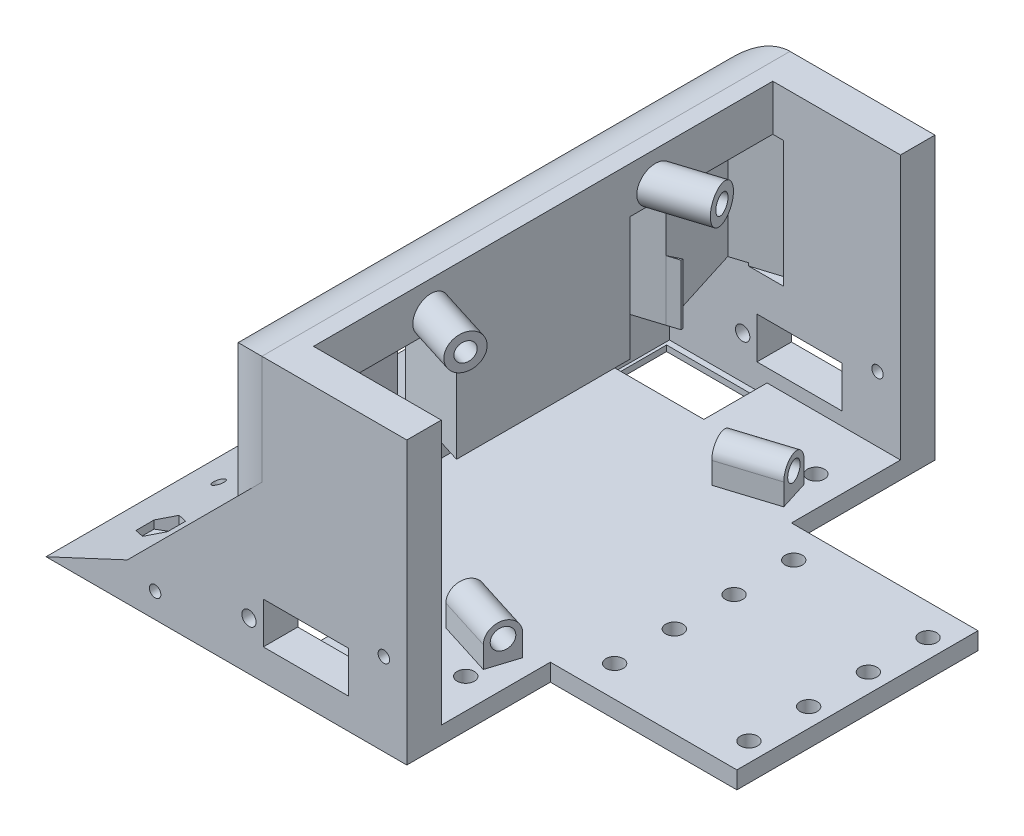
from build123d import *

# Parameters (mm, degrees)
EXTRUDE_1_DEPTH           = 48
EXTRUDE_1_DEPTH_BACK      = 48
SKETCH_2_W                = 35
SKETCH_2_H                = 22
CUT_EXTRUDE_1_DEPTH       = 50
SKETCH_3_W                = 29.5
SKETCH_3_H                = 8.4
CUT_EXTRUDE_2_DEPTH       = 50
SKETCH_7_W                = 29.5
SKETCH_7_H                = 8.4
CUT_EXTRUDE_6_DEPTH       = 116
CUT_EXTRUDE_7_DEPTH       = 40
CUT_EXTRUDE_7_DEPTH_BACK  = 40
SKETCH_8_W                = 4.551430991
SKETCH_8_H                = 6.321078777
CUT_EXTRUDE_8_DEPTH       = 119
SKETCH_11_R               = 1.25
EXTRUDE_2_DEPTH           = 8
SKETCH_12_R               = 1.25
EXTRUDE_3_DEPTH           = 8
CUT_EXTRUDE_9_DEPTH       = 3
SKETCH_10_R               = 1.5
CUT_EXTRUDE_11_DEPTH      = 3
SKETCH_14_W               = 32.5
SKETCH_14_H               = 42
SKETCH_14_R               = 1.5
EXTRUDE_4_DEPTH           = 1.021078777
SKETCH_15_W               = 96
SKETCH_15_H               = 1
CUT_EXTRUDE_12_DEPTH      = 120.625457157
CUT_EXTRUDE_13_DEPTH      = 94.036621877
CUT_EXTRUDE_13_DEPTH_BACK = 94.036621877
SKETCH_16_W               = 2
SKETCH_16_H               = 20.042157554
CUT_EXTRUDE_14_DEPTH      = 18
SKETCH_19_W               = 17
SKETCH_19_H               = 11
CUT_EXTRUDE_15_DEPTH      = 10
SKETCH_20_W               = 17
SKETCH_20_H               = 11
SKETCH_20_W_2             = 16
SKETCH_20_H_2             = 9
EXTRUDE_5_DEPTH           = 1
EXTRUDE_6_DEPTH           = 10
CUT_EXTRUDE_16_DEPTH      = 22
SKETCH_24_W               = 92
SKETCH_24_H               = 19
EXTRUDE_7_DEPTH           = 3
CUT_EXTRUDE_START         = -19.521079
CUT_EXTRUDE_17_DEPTH      = 19.521079
CUT_EXTRUDE_18_DEPTH      = 11
EXTRUDE_8_REACH           = 111.942
CUT_EXTRUDE_19_DEPTH      = 4
EXTRUDE_9_DEPTH           = 11
EXTRUDE_10_DEPTH          = 3
SKETCH_37_R               = 1.5
CUT_EXTRUDE_20_DEPTH      = 10
CUT_EXTRUDE_START_2       = -2
CUT_EXTRUDE_21_DEPTH      = 10
SKETCH_39_R               = 1.5
CUT_EXTRUDE_22_DEPTH      = 10
SKETCH_40_R               = 1
CUT_EXTRUDE_23_DEPTH      = 115.695894512
SKETCH_42_R               = 1.779724169
EXTRUDE_11_DEPTH          = 10
SKETCH_43_R               = 1.650133076
EXTRUDE_12_DEPTH          = 10
EXTRUDE_13_REACH          = 90.598
SKETCH_44_R               = 3.089258807
SKETCH_44_R_2             = 1.627891813
EXTRUDE_14_REACH          = 90.598
SKETCH_45_R               = 3.004758467
SKETCH_45_R_2             = 1.620063924
EXTRUDE_15_DEPTH          = 5
FILLET_1_R                = 10
SKETCH_47_R               = 1.5
CUT_EXTRUDE_24_DEPTH      = 5
SKETCH_48_R               = 1
CUT_EXTRUDE_25_DEPTH      = 5
CUT_EXTRUDE_START_3       = -1.5
CUT_EXTRUDE_26_DEPTH      = 5


with BuildPart() as part:
    # Эскиз1 → Бобышка-Вытянуть1 (new, two sides: drawn at the far end of the back side and taken through both)
    with BuildSketch(Plane.XY.offset(-EXTRUDE_1_DEPTH_BACK)):
        Polygon((-50, -50), (-33.686459833, -42.392871289), (-20.251430991, -28.957842446), (-7.251430991, -28.957842446), (-7.251430991, -39.957842446), (10.448569009, -39.957842446), (10.448569009, -28.957842446), (15, -28.957842446), (15, -47), (50, -47), (50, -50), align=None)
    extrude(amount=EXTRUDE_1_DEPTH + EXTRUDE_1_DEPTH_BACK)

    # Эскиз2 → Вырез-Вытянуть1 (cut)
    with BuildSketch(Plane(origin=(0, -47, 0), x_dir=(1, 0, 0), z_dir=(0, 1, 0))):
        with Locations((32.5, 37)):
            Rectangle(SKETCH_2_W, SKETCH_2_H)
        with Locations((32.5, -37)):
            Rectangle(SKETCH_2_W, SKETCH_2_H)
    extrude(amount=-CUT_EXTRUDE_1_DEPTH, mode=Mode.SUBTRACT)

    # Эскиз3 → Вырез-Вытянуть2 (cut)
    with BuildSketch(Plane(origin=(0, 0, 0), x_dir=(0, 0, -1), z_dir=(1, 0, 0))):
        with Locations((-24, -33.657842446)):
            Rectangle(SKETCH_3_W, SKETCH_3_H)
        with Locations((24, -33.657842446)):
            Rectangle(SKETCH_3_W, SKETCH_3_H)
    extrude(amount=-CUT_EXTRUDE_2_DEPTH, mode=Mode.SUBTRACT)

    # Эскиз7 → Вырез-Вытянуть6 (cut)
    with BuildSketch(Plane.XY.offset(48)):
        with Locations((0.25, -39.478921223)):
            Rectangle(SKETCH_7_W, SKETCH_7_H)
    extrude(amount=-CUT_EXTRUDE_6_DEPTH, mode=Mode.SUBTRACT)


with BuildPart() as cut_extrude_6_piece_1:
    # of the separate pieces the step leaves, piece 1, a body of its own (cut_extrude_6_pieces)
    add(part.part.solids().sort_by_distance((-50, -50, 48))[0])


with BuildPart() as cut_extrude_6_piece_2:
    # of the separate pieces the step leaves, piece 2, a body of its own (cut_extrude_6_pieces)
    add(part.part.solids().sort_by_distance((15, -35.278921223, 48))[0])


with BuildPart() as cut_extrude_7_tool:
    # Эскиз6 → Вырез-Вытянуть7 (new, two sides: drawn at the far end of the back side and taken through both)
    with BuildSketch(Plane.XY.offset(-CUT_EXTRUDE_7_DEPTH_BACK)):
        with BuildLine():
            Line((15, -32.978921223), (5.3, -32.978921223))
            Line((5.3, -32.978921223), (5.3, -27.078921223))
            Line((5.3, -27.078921223), (-4.8, -27.078921223))
            Line((-4.8, -27.078921223), (-4.8, -32.978921223))
            Line((-4.8, -32.978921223), (-14.5, -32.978921223))
            Line((-14.5, -32.978921223), (-14.5, -35.728921223))
            Line((-14.5, -35.728921223), (-20.25, -35.728921223))
            ThreePointArc((-20.25, -35.728921223), (-24, -39.478921223), (-20.25, -43.228921223))
            Line((-20.25, -43.228921223), (-14.5, -43.228921223))
            Line((-14.5, -43.228921223), (-14.5, -45.978921223))
            Line((-14.5, -45.978921223), (15, -45.978921223))
            Line((15, -45.978921223), (15, -43.228921223))
            Line((15, -43.228921223), (16.75, -43.228921223))
            ThreePointArc((16.75, -43.228921223), (20.5, -39.478921223), (16.75, -35.728921223))
            Line((16.75, -35.728921223), (15, -35.728921223))
            Line((15, -35.728921223), (15, -32.978921223))
        make_face()
    extrude(amount=CUT_EXTRUDE_7_DEPTH + CUT_EXTRUDE_7_DEPTH_BACK)


with BuildPart() as cut_extrude_6_piece_1_1:
    add(cut_extrude_6_piece_1.part)

    # Вырез-Вытянуть7: cut by cut_extrude_7_tool
    add(cut_extrude_7_tool.part, mode=Mode.SUBTRACT)

    # Эскиз11 → Бобышка-Вытянуть2 (add)
    with BuildSketch(Plane(origin=(0, 0, -48), x_dir=(-1, 0, 0), z_dir=(0, 0, -1))):
        Polygon((14.5, -43.678921223), (10, -43.678921223), (10, -36.459984998), (-4.798276813, -36.459984998), (-4.798276813, -43.678921223), (-15, -43.678921223), (-15, -35.278921223), (-15, -28.957842446), (7.251430991, -28.957842446), (7.251430991, -35.278921223), (14.5, -35.278921223), align=None)
        with Locations((12.5, -40.578921223)):
            Circle(SKETCH_11_R, mode=Mode.SUBTRACT)
    extrude(amount=-EXTRUDE_2_DEPTH)

    # Эскиз12 → Бобышка-Вытянуть3 (add)
    with BuildSketch(Plane.XY.offset(48)):
        Polygon((15, -28.957842446), (15, -35.278921223), (15, -43.678921223), (4.798276813, -43.678921223), (4.798276813, -36.459984998), (-10, -36.459984998), (-10, -43.678921223), (-14.5, -43.678921223), (-14.5, -35.278921223), (-7.251430991, -35.278921223), (-7.251430991, -28.957842446), align=None)
        with Locations(Location((-12.5, -40.578921223, 0), (0, 0, 180))):
            Circle(SKETCH_12_R, mode=Mode.SUBTRACT)
    extrude(amount=-EXTRUDE_3_DEPTH)

    # Эскиз13 → Вырез-Вытянуть9 (cut)
    with BuildSketch(Plane(origin=(0, -47, 0), x_dir=(1, 0, 0), z_dir=(0, 1, 0))):
        Polygon((15, -26), (50, -26), (50, -21), (50, 21), (50, 26), (15, 26), (15, 21), (47.5, 21), (47.5, -21), (15, -21), align=None)
    extrude(amount=-CUT_EXTRUDE_9_DEPTH, mode=Mode.SUBTRACT)

    # Эскиз10 → Вырез-Вытянуть11 (cut)
    with BuildSketch(Plane(origin=(0, -47, 0), x_dir=(1, 0, 0), z_dir=(0, 1, 0))):
        with Locations(Location((44.2, -15.6, 0), (0, 0, 270))):
            Circle(SKETCH_10_R)
        with Locations(Location((20.8, -15.6, 0), (0, 0, 270))):
            Circle(SKETCH_10_R)
        with Locations(Location((20.8, -5.2, 0), (0, 0, 270))):
            Circle(SKETCH_10_R)
        with Locations(Location((20.8, 5.2, 0), (0, 0, 270))):
            Circle(SKETCH_10_R)
        with Locations(Location((20.8, 15.6, 0), (0, 0, 270))):
            Circle(SKETCH_10_R)
        with Locations(Location((44.2, 15.6, 0), (0, 0, 270))):
            Circle(SKETCH_10_R)
        with Locations(Location((44.2, 5.2, 0), (0, 0, 270))):
            Circle(SKETCH_10_R)
        with Locations(Location((44.2, -5.2, 0), (0, 0, 270))):
            Circle(SKETCH_10_R)
    extrude(amount=-CUT_EXTRUDE_11_DEPTH, mode=Mode.SUBTRACT)

    # Эскиз14 → Бобышка-Вытянуть4 (add)
    with BuildSketch(Plane(origin=(0, -47, 0), x_dir=(1, 0, 0), z_dir=(0, 1, 0))):
        with Locations((31.25, 0)):
            Rectangle(SKETCH_14_W, SKETCH_14_H)
        with Locations(Location((20.8, -15.6, 0), (0, 0, 270))):
            Circle(SKETCH_14_R, mode=Mode.SUBTRACT)
        with Locations(Location((20.8, -5.2, 0), (0, 0, 270))):
            Circle(SKETCH_14_R, mode=Mode.SUBTRACT)
        with Locations(Location((20.8, 5.2, 0), (0, 0, 270))):
            Circle(SKETCH_14_R, mode=Mode.SUBTRACT)
        with Locations(Location((20.8, 15.6, 0), (0, 0, 270))):
            Circle(SKETCH_14_R, mode=Mode.SUBTRACT)
        with Locations(Location((44.2, 15.6, 0), (0, 0, 270))):
            Circle(SKETCH_14_R, mode=Mode.SUBTRACT)
        with Locations(Location((44.2, 5.2, 0), (0, 0, 270))):
            Circle(SKETCH_14_R, mode=Mode.SUBTRACT)
        with Locations(Location((44.2, -5.2, 0), (0, 0, 270))):
            Circle(SKETCH_14_R, mode=Mode.SUBTRACT)
        with Locations(Location((44.2, -15.6, 0), (0, 0, 270))):
            Circle(SKETCH_14_R, mode=Mode.SUBTRACT)
    extrude(amount=EXTRUDE_4_DEPTH)

    # Эскиз15 → Вырез-Вытянуть12 (cut, through all)
    with BuildSketch(Plane(origin=(47.5, 0, 0), x_dir=(0, 0, -1), z_dir=(1, 0, 0))):
        with Locations((0, -49.5)):
            Rectangle(SKETCH_15_W, SKETCH_15_H)
    extrude(amount=-CUT_EXTRUDE_12_DEPTH, mode=Mode.SUBTRACT)

    # Эскиз16 → Вырез-Вытянуть13 (cut, two sides: drawn at the far end of the back side and taken through both)
    with BuildSketch(Plane(origin=(15, 0, 0), x_dir=(0, 0, -1), z_dir=(1, 0, 0)).offset(-CUT_EXTRUDE_13_DEPTH_BACK)):
        with Locations((-47, -38.978921223)):
            Rectangle(SKETCH_16_W, SKETCH_16_H)
        with Locations((47, -38.978921223)):
            Rectangle(SKETCH_16_W, SKETCH_16_H)
    extrude(amount=CUT_EXTRUDE_13_DEPTH + CUT_EXTRUDE_13_DEPTH_BACK, mode=Mode.SUBTRACT)

    # Эскиз18 → Вырез-Вытянуть14 (cut)
    with BuildSketch(Plane(origin=(-7.251430991, 0, 0), x_dir=(0, 0, -1), z_dir=(1, 0, 0))):
        Polygon((-40, -30.968381835), (-40, -43.228921223), (-40, -45.978921223), (40, -45.978921223), (40, -43.228921223), (40, -30.968381835), (40, -29.468381835), (-40, -29.468381835), align=None)
    extrude(amount=-CUT_EXTRUDE_14_DEPTH, mode=Mode.SUBTRACT)

    # Эскиз19 → Вырез-Вытянуть15 (cut)
    with BuildSketch(Plane(origin=(0, -45.978921223, 0), x_dir=(1, 0, 0), z_dir=(0, 1, 0))):
        with Locations((-16.751430991, -34.5)):
            Rectangle(SKETCH_19_W, SKETCH_19_H)
        with Locations((-16.751430991, 34.5)):
            Rectangle(SKETCH_19_W, SKETCH_19_H)
    extrude(amount=-CUT_EXTRUDE_15_DEPTH, mode=Mode.SUBTRACT)

    # Эскиз20 → Бобышка-Вытянуть5 (add)
    # profile 1 of 2: a face of its own
    with BuildSketch(Plane.XZ.offset(49)):
        with Locations((-16.751430991, -34.5)):
            Rectangle(SKETCH_20_W, SKETCH_20_H)
        with Locations((-16.751430991, -34.5)):
            Rectangle(SKETCH_20_W_2, SKETCH_20_H_2, mode=Mode.SUBTRACT)
    # profile 2 of 2: a face of its own
    with BuildSketch(Plane.XZ.offset(49)):
        with Locations((-16.751430991, 34.5)):
            Rectangle(SKETCH_20_W, SKETCH_20_H)
        with Locations((-16.751430991, 34.5)):
            Rectangle(SKETCH_20_W_2, SKETCH_20_H_2, mode=Mode.SUBTRACT)
    extrude(amount=-EXTRUDE_5_DEPTH)

    # Эскиз21 → Бобышка-Вытянуть6 (add)
    with BuildSketch(Plane(origin=(0, -28.957842446, 0), x_dir=(1, 0, 0), z_dir=(0, 1, 0))):
        Polygon((-20.251430991, -46), (15, -46), (15, -40), (-7.251430991, -40), (-7.251430991, 40), (15, 40), (15, 46), (-20.251430991, 46), align=None)
    extrude(amount=EXTRUDE_6_DEPTH)

    # Эскиз23 → Вырез-Вытянуть16 (cut)
    with BuildSketch(Plane.XY.offset(9.25)):
        Polygon((-29.151430991, -37.857842446), (-25.251430991, -37.857842446), (-25.251430991, -33.957842446), align=None)
    extrude(amount=-CUT_EXTRUDE_16_DEPTH, mode=Mode.SUBTRACT)

    # Эскиз24 → Бобышка-Вытянуть7 (add)
    with BuildSketch(Plane(origin=(4.353205728, -4.353205728, 0), x_dir=(0, 0, 1), z_dir=(-0.7071067811865485, 0.7071067811865466, 0))):
        with Locations((0, -44.296210945)):
            Rectangle(SKETCH_24_W, SKETCH_24_H)
    extrude(amount=-EXTRUDE_7_DEPTH)

    # Эскиз25 → Вырез-Вытянуть17 (cut)
    with BuildSketch(Plane(origin=(0, -18.957842446, 0), x_dir=(1, 0, 0), z_dir=(0, 1, 0)).offset(CUT_EXTRUDE_START)):
        Polygon((-5.732587345, -24.487517777), (-10.024313623, -23.134341679), (-24.044692382, -18.713733237), (-43.109006788, -12.702777993), (-42.92180577, -3.849304684), (-7.468314327, -15.027747597), (-3.176588049, -16.380923695), align=None)
        Polygon((-3.176588049, 16.380923695), (-7.468314327, 15.027747597), (-42.757931091, 3.900974172), (-42.56821726, 12.873288277), (-10.024313623, 23.134341679), (-5.732587345, 24.487517777), align=None)
    extrude(amount=CUT_EXTRUDE_17_DEPTH, mode=Mode.SUBTRACT)

    # Эскиз26 → Вырез-Вытянуть18 (cut)
    with BuildSketch(Plane(origin=(0, -18.957842446, 0), x_dir=(1, 0, 0), z_dir=(0, 1, 0))):
        Polygon((-1.33988484, 27.183192963), (-5.933885355, 41.753501116), (-14.228625887, 39.138179472), (-9.258743123, 23.37572513), align=None)
        Polygon((-14.228625887, -39.138179472), (-9.258743123, -23.37572513), (-1.33988484, -27.183192963), (-5.933885355, -41.753501116), align=None)
    extrude(amount=-CUT_EXTRUDE_18_DEPTH, mode=Mode.SUBTRACT)


with BuildPart() as cut_extrude_6_piece_2_1:
    add(cut_extrude_6_piece_2.part)

    # Вырез-Вытянуть7: cut by cut_extrude_7_tool
    add(cut_extrude_7_tool.part, mode=Mode.SUBTRACT)

    # Эскиз8 → Вырез-Вытянуть8 (cut)
    with BuildSketch(Plane(origin=(0, 0, -48), x_dir=(-1, 0, 0), z_dir=(0, 0, -1))):
        with Locations((-12.724284505, -32.118381834)):
            Rectangle(SKETCH_8_W, SKETCH_8_H)
    extrude(amount=-CUT_EXTRUDE_8_DEPTH, mode=Mode.SUBTRACT)


with BuildPart() as cut_extrude_18_piece_1:
    # of the separate pieces the step leaves, piece 1, a body of its own (cut_extrude_18_pieces)
    add(cut_extrude_6_piece_1_1.part.solids().sort_by_distance((-47.855493079, -49, 46))[0])

    # Бобышка-Вытянуть8: up to this face of the body (flat: up to its plane)
    extrude_8_end = Plane(cut_extrude_18_piece_1.part.faces().sort_by_distance((-8.696715334, -46.989460612, 40))[0])
    # Эскиз31 → Бобышка-Вытянуть8 (add, up to the picked face)
    with BuildSketch(Plane.XY.offset(-40), mode=Mode.PRIVATE) as extrude_8_sk1:
        Polygon((-18.130110647, -31.07916279), (-19.740891602, -29.468381835), (-17.345266843, -29.468381835), align=None)
    extrude_8_tool1 = split(extrude(extrude_8_sk1.sketch, amount=EXTRUDE_8_REACH, mode=Mode.PRIVATE), bisect_by=extrude_8_end, keep=Keep.BOTH, mode=Mode.PRIVATE)
    add(extrude_8_tool1.solids().sort_by(Axis((-18.405423, -30.005309, -40), (0, 0, 1)))[0])

    # Эскиз34 → Вырез-Вытянуть19 (cut)
    with BuildSketch(Plane(origin=(0, -29.468381835, 0), x_dir=(1, 0, 0), z_dir=(0, 1, 0))):
        Polygon((-17.345266843, 20.826053995), (-19.740891602, 20.07071641), (-19.740891602, 11.158218846), (-17.345266843, 11.913556431), align=None)
        Polygon((-19.740891602, -11.158218846), (-17.345266843, -11.913556431), (-17.345266843, -20.826053995), (-19.740891602, -20.07071641), align=None)
    extrude(amount=-CUT_EXTRUDE_19_DEPTH, mode=Mode.SUBTRACT)

    # Эскиз35 → Бобышка-Вытянуть9 (add)
    with BuildSketch(Plane(origin=(0, -18.957842446, 0), x_dir=(1, 0, 0), z_dir=(0, 1, 0))):
        Polygon((-9.258743123, 23.37572513), (-14.228625887, 39.138179472), (-5.933885355, 41.753501116), (-5.381008577, 40), (15, 40), (15, 46), (-20.251430991, 46), (-20.251430991, 19.909743959), align=None)
        Polygon((-20.251430991, -10.997246395), (-7.251430991, -15.096130651), (-7.251430991, 15.096130651), (-20.251430991, 10.997246395), align=None)
        Polygon((-14.228625887, -39.138179472), (-9.258743123, -23.37572513), (-20.251430991, -19.909743959), (-20.251430991, -46), (15, -46), (15, -40), (-5.381008577, -40), (-5.933885355, -41.753501116), align=None)
    extrude(amount=EXTRUDE_9_DEPTH)

    # Эскиз36 → Бобышка-Вытянуть10 (add)
    with BuildSketch(Plane(origin=(0, -7.957842446, 0), x_dir=(1, 0, 0), z_dir=(0, 1, 0))):
        Polygon((-20.251430991, -19.909743959), (-20.251430991, -46), (15, -46), (15, -40), (-7.251430991, -40), (-7.251430991, 40), (15, 40), (15, 46), (-20.251430991, 46), (-20.251430991, 10.997246395), align=None)
    extrude(amount=EXTRUDE_10_DEPTH)

    # Эскиз37 → Вырез-Вытянуть20 (cut)
    with BuildSketch(Plane(origin=(0, -49, 0), x_dir=(-1, 0, 0), z_dir=(0, -1, 0))):
        with Locations(Location((37.855493079, 36, 0), (0, 0, 90))):
            Circle(SKETCH_37_R)
        with Locations((37.855493079, -36)):
            Circle(SKETCH_37_R)
    extrude(amount=-CUT_EXTRUDE_20_DEPTH, mode=Mode.SUBTRACT)

    # Эскиз38 → Вырез-Вытянуть21 (cut)
    with BuildSketch(Plane.XZ.offset(49).offset(CUT_EXTRUDE_START_2)):
        Polygon((-37.855493079, -32.824573519), (-40.605493079, -34.41228676), (-40.605493079, -37.58771324), (-37.855493079, -39.175426481), (-35.105493079, -37.58771324), (-35.105493079, -34.41228676), align=None)
        Polygon((-35.105493079, 34.41228676), (-37.855493079, 32.824573519), (-40.605493079, 34.41228676), (-40.605493079, 37.58771324), (-37.855493079, 39.175426481), (-35.105493079, 37.58771324), align=None)
    extrude(amount=-CUT_EXTRUDE_21_DEPTH, mode=Mode.SUBTRACT)

    # Эскиз39 → Вырез-Вытянуть22 (cut)
    with BuildSketch(Plane(origin=(0, -45.978921223, 0), x_dir=(1, 0, 0), z_dir=(0, 1, 0))):
        with Locations(Location((9.763297689, -30.5, 0), (0, 0, 270))):
            Circle(SKETCH_39_R)
        with Locations(Location((9.763297689, 30.5, 0), (0, 0, 270))):
            Circle(SKETCH_39_R)
    extrude(amount=-CUT_EXTRUDE_22_DEPTH, mode=Mode.SUBTRACT)

    # Эскиз40 → Вырез-Вытянуть23 (cut, through all)
    with BuildSketch(Plane.XY.offset(46)):
        with Locations((-28.845458385, -44.710050328)):
            Circle(SKETCH_40_R)
        with Locations((10.992087761, -34.64156265)):
            Circle(SKETCH_40_R)
    extrude(amount=-CUT_EXTRUDE_23_DEPTH, mode=Mode.SUBTRACT)

    # Эскиз42 → Бобышка-Вытянуть11 (add)
    with BuildSketch(Plane(origin=(7.819521326, 0, 2.465485604), x_dir=(0.300705799504272, 0, -0.9537169507482274), z_dir=(0.9537169507482273, 0, 0.30070579950427195))):
        with BuildLine():
            Line((-23.561659777, -42.228921223), (-23.561659777, -46.548803265))
            Line((-23.561659777, -46.548803265), (-18.094306315, -46.548803265))
            Line((-18.094306315, -46.548803265), (-18.094306315, -42.228921223))
            ThreePointArc((-18.094306315, -42.228921223), (-20.827983046, -39.495244492), (-23.561659777, -42.228921223))
        make_face()
        with Locations(Location((-20.827983046, -42.228921223, 0), (0, 0, 180))):
            Circle(SKETCH_42_R, mode=Mode.SUBTRACT)
    extrude(amount=EXTRUDE_11_DEPTH)

    # Эскиз43 → Бобышка-Вытянуть12 (add)
    with BuildSketch(Plane(origin=(7.819521326, 0, -2.465485604), x_dir=(-0.300705799504272, 0, -0.9537169507482274), z_dir=(0.9537169507482273, 0, -0.30070579950427195))):
        with BuildLine():
            Line((18.124879759, -42.228921223), (18.124879759, -47.781885183))
            Line((18.124879759, -47.781885183), (23.531086333, -47.781885183))
            Line((23.531086333, -47.781885183), (23.531086333, -42.228921223))
            ThreePointArc((23.531086333, -42.228921223), (20.827983046, -39.525817936), (18.124879759, -42.228921223))
        make_face()
        with Locations(Location((20.827983046, -42.228921223, 0), (0, 0, 180))):
            Circle(SKETCH_43_R, mode=Mode.SUBTRACT)
    extrude(amount=EXTRUDE_12_DEPTH)

    # Бобышка-Вытянуть13: up to this plane
    extrude_13_end = Plane(origin=(-7.251430991, -28.957842446, -48), z_dir=(1, 0, 0))
    # Эскиз44 → Бобышка-Вытянуть13 (add, up to the surface)
    with BuildSketch(Plane(origin=(7.819521326, 0, -2.465485604), x_dir=(-0.300705799504272, 0, -0.9537169507482274), z_dir=(0.9537169507482273, 0, -0.30070579950427195)), mode=Mode.PRIVATE) as extrude_13_sk1:
        with Locations((20.827983046, -5.228921223)):
            Circle(SKETCH_44_R)
        with Locations((20.827983046, -5.228921223)):
            Circle(SKETCH_44_R_2, mode=Mode.SUBTRACT)
    extrude_13_tool1 = split(extrude(extrude_13_sk1.sketch, amount=-EXTRUDE_13_REACH, mode=Mode.PRIVATE), bisect_by=extrude_13_end, keep=Keep.BOTH, mode=Mode.PRIVATE)
    add(extrude_13_tool1.solids().sort_by_distance((2.459109, -5.228921, -19.466541))[0])

    # Бобышка-Вытянуть14: up to this plane
    extrude_14_end = Plane(origin=(-7.251430991, -28.957842446, -48), z_dir=(1, 0, 0))
    # Эскиз45 → Бобышка-Вытянуть14 (add, up to the surface)
    with BuildSketch(Plane(origin=(7.819521326, 0, 2.465485604), x_dir=(0.300705799504272, 0, -0.9537169507482274), z_dir=(0.9537169507482273, 0, 0.30070579950427195)), mode=Mode.PRIVATE) as extrude_14_sk1:
        with Locations((-20.827983046, -5.228921223)):
            Circle(SKETCH_45_R)
        with Locations((-20.827983046, -5.228921223)):
            Circle(SKETCH_45_R_2, mode=Mode.SUBTRACT)
    extrude_14_tool1 = split(extrude(extrude_14_sk1.sketch, amount=-EXTRUDE_14_REACH, mode=Mode.PRIVATE), bisect_by=extrude_14_end, keep=Keep.BOTH, mode=Mode.PRIVATE)
    add(extrude_14_tool1.solids().sort_by_distance((0.678434, -5.228921, 25.114121))[0])

    # Эскиз46 → Бобышка-Вытянуть15 (add)
    with BuildSketch(Plane(origin=(0, -4.957842446, 0), x_dir=(1, 0, 0), z_dir=(0, 1, 0))):
        Polygon((15, 46), (-20.251430991, 46), (-20.251430991, -46), (15, -46), (15, -40), (-7.251430991, -40), (-7.251430991, -22.690108707), (-7.251430991, -21.227114958), (-7.251430991, -17.877643907), (-7.251430991, -16.414650158), (-7.251430991, 16.325696294), (-7.251430991, 17.869319344), (-7.251430991, 21.235439522), (-7.251430991, 22.779062571), (-7.251430991, 40), (15, 40), align=None)
    extrude(amount=EXTRUDE_15_DEPTH)

    # Скругление1
    # the kernel refuses this fillet: 10 mm, written as the material it takes off along each edge
    with BuildSketch(Plane(origin=(-20.251430991, 0.042157554, -71), x_dir=(0, -1, 0), z_dir=(0, 0, 1))) as fillet_1_piece_1:
        with BuildLine():
            CenterArc((FILLET_1_R, FILLET_1_R), FILLET_1_R, 180, 90)
            Line((0, FILLET_1_R), (0, 0))
            Line((0, 0), (FILLET_1_R, 0))
        make_face()
    extrude(amount=142, mode=Mode.SUBTRACT)
    with BuildSketch(Plane(origin=(-20.251430991, -18.957842446, 46), x_dir=(0, 0, -1), z_dir=(0, 1, 0))) as fillet_1_piece_2:
        with BuildLine():
            CenterArc((FILLET_1_R, -FILLET_1_R), FILLET_1_R, 90, 90)
            Line((0, -FILLET_1_R), (0, 0))
            Line((0, 0), (FILLET_1_R, 0))
        make_face()
    extrude(amount=11, mode=Mode.SUBTRACT)
    with BuildSketch(Plane(origin=(-20.251430991, -18.957842446, -46), x_dir=(0, 0, 1), z_dir=(0, 1, 0))) as fillet_1_piece_3:
        with BuildLine():
            CenterArc((FILLET_1_R, FILLET_1_R), FILLET_1_R, 180, 90)
            Line((0, FILLET_1_R), (0, 0))
            Line((0, 0), (FILLET_1_R, 0))
        make_face()
    extrude(amount=11, mode=Mode.SUBTRACT)
    with BuildSketch(Plane(origin=(-20.251430991, -53.957842446, -46), x_dir=(0, 0, 1), z_dir=(0, 1, 0))) as fillet_1_piece_4_section:
        with BuildLine():
            CenterArc((FILLET_1_R, FILLET_1_R), FILLET_1_R, 180, 90)
            Line((0, FILLET_1_R), (0, 0))
            Line((0, 0), (FILLET_1_R, 0))
        make_face()
    fillet_1_piece_4 = extrude(amount=35, mode=Mode.PRIVATE)
    fillet_1_piece_4 = split(fillet_1_piece_4, bisect_by=Plane(origin=(-16.504052653, -25.210464108, -43.381129818), z_dir=(-0.7071067811865488, 0.7071067811865464, 0)), keep=Keep.TOP, mode=Mode.PRIVATE)
    add(fillet_1_piece_4, mode=Mode.SUBTRACT)
    with BuildSketch(Plane(origin=(-20.251430991, -7.957842446, -46), x_dir=(0, 0, 1), z_dir=(0, 1, 0))) as fillet_1_piece_5:
        with BuildLine():
            CenterArc((FILLET_1_R, FILLET_1_R), FILLET_1_R, 180, 90)
            Line((0, FILLET_1_R), (0, 0))
            Line((0, 0), (FILLET_1_R, 0))
        make_face()
    extrude(amount=3, mode=Mode.SUBTRACT)
    with BuildSketch(Plane(origin=(-20.251430991, -4.957842446, -46), x_dir=(0, 0, 1), z_dir=(0, 1, 0))) as fillet_1_piece_6:
        with BuildLine():
            CenterArc((FILLET_1_R, FILLET_1_R), FILLET_1_R, 180, 90)
            Line((0, FILLET_1_R), (0, 0))
            Line((0, 0), (FILLET_1_R, 0))
        make_face()
    extrude(amount=30, mode=Mode.SUBTRACT)
    with BuildSketch(Plane(origin=(-20.251430991, -53.957842446, 46), x_dir=(0, 0, -1), z_dir=(0, 1, 0))) as fillet_1_piece_7_section:
        with BuildLine():
            CenterArc((FILLET_1_R, -FILLET_1_R), FILLET_1_R, 90, 90)
            Line((0, -FILLET_1_R), (0, 0))
            Line((0, 0), (FILLET_1_R, 0))
        make_face()
    fillet_1_piece_7 = extrude(amount=35, mode=Mode.PRIVATE)
    fillet_1_piece_7 = split(fillet_1_piece_7, bisect_by=Plane(origin=(-16.504052653, -25.210464108, 43.381129818), z_dir=(-0.7071067811865488, 0.7071067811865464, 0)), keep=Keep.TOP, mode=Mode.PRIVATE)
    add(fillet_1_piece_7, mode=Mode.SUBTRACT)
    with BuildSketch(Plane(origin=(-20.251430991, -7.957842446, 46), x_dir=(0, 0, -1), z_dir=(0, 1, 0))) as fillet_1_piece_8:
        with BuildLine():
            CenterArc((FILLET_1_R, -FILLET_1_R), FILLET_1_R, 90, 90)
            Line((0, -FILLET_1_R), (0, 0))
            Line((0, 0), (FILLET_1_R, 0))
        make_face()
    extrude(amount=3, mode=Mode.SUBTRACT)
    with BuildSketch(Plane(origin=(-20.251430991, -4.957842446, 46), x_dir=(0, 0, -1), z_dir=(0, 1, 0))) as fillet_1_piece_9:
        with BuildLine():
            CenterArc((FILLET_1_R, -FILLET_1_R), FILLET_1_R, 90, 90)
            Line((0, -FILLET_1_R), (0, 0))
            Line((0, 0), (FILLET_1_R, 0))
        make_face()
    extrude(amount=30, mode=Mode.SUBTRACT)

    # Эскиз47 → Вырез-Вытянуть24 (cut)
    with BuildSketch(Plane(origin=(4.353205728, -4.353205728, 0), x_dir=(0, 0, 1), z_dir=(-0.7071067811865485, 0.7071067811865466, 0))):
        with Locations(Location((-32.521447951, -44.364529328, 0), (0, 0, 270))):
            Circle(SKETCH_47_R)
        with Locations(Location((32.521447951, -44.364529328, 0), (0, 0, 340.417350016))):
            Circle(SKETCH_47_R)
    extrude(amount=-CUT_EXTRUDE_24_DEPTH, mode=Mode.SUBTRACT)

    # Эскиз48 → Вырез-Вытянуть25 (cut)
    with BuildSketch(Plane(origin=(10.22080132, -21.918579164, 0), x_dir=(0.9063077870366492, 0.422618261740701, 0), z_dir=(-0.42261826174070105, 0.9063077870366493, 0))):
        with Locations(Location((-56.263201647, 23, 0), (0, 0, 180))):
            Circle(SKETCH_48_R)
        with Locations(Location((-56.263201647, -23, 0), (0, 0, 180))):
            Circle(SKETCH_48_R)
    extrude(amount=-CUT_EXTRUDE_25_DEPTH, mode=Mode.SUBTRACT)

    # Эскиз49 → Вырез-Вытянуть26 (cut)
    with BuildSketch(Plane(origin=(10.22080132, -21.918579164, 0), x_dir=(0.9063077870366492, 0.422618261740701, 0), z_dir=(-0.42261826174070105, 0.9063077870366493, 0)).offset(CUT_EXTRUDE_START_3)):
        Polygon((-56.263201647, 20.690598923), (-54.263201647, 21.845299462), (-54.263201647, 24.154700538), (-56.263201647, 25.309401077), (-58.263201647, 24.154700538), (-58.263201647, 21.845299462), align=None)
        Polygon((-58.263201647, -21.845299462), (-56.263201647, -20.690598923), (-54.263201647, -21.845299462), (-54.263201647, -24.154700538), (-56.263201647, -25.309401077), (-58.263201647, -24.154700538), align=None)
    extrude(amount=-CUT_EXTRUDE_26_DEPTH, mode=Mode.SUBTRACT)


with BuildPart() as cut_extrude_18_piece_2:
    # of the separate pieces the step leaves, piece 2, a body of its own (cut_extrude_18_pieces)
    add(cut_extrude_6_piece_1_1.part.solids().sort_by_distance((-7.251430991, -18.957842446, -24.008628214))[0])


with BuildPart() as cut_extrude_18_piece_3:
    # of the separate pieces the step leaves, piece 3, a body of its own (cut_extrude_18_pieces)
    add(cut_extrude_6_piece_1_1.part.solids().sort_by_distance((-7.251430991, -18.957842446, 24.008628214))[0])


solid = Compound([cut_extrude_18_piece_1.part, cut_extrude_18_piece_2.part, cut_extrude_18_piece_3.part])
